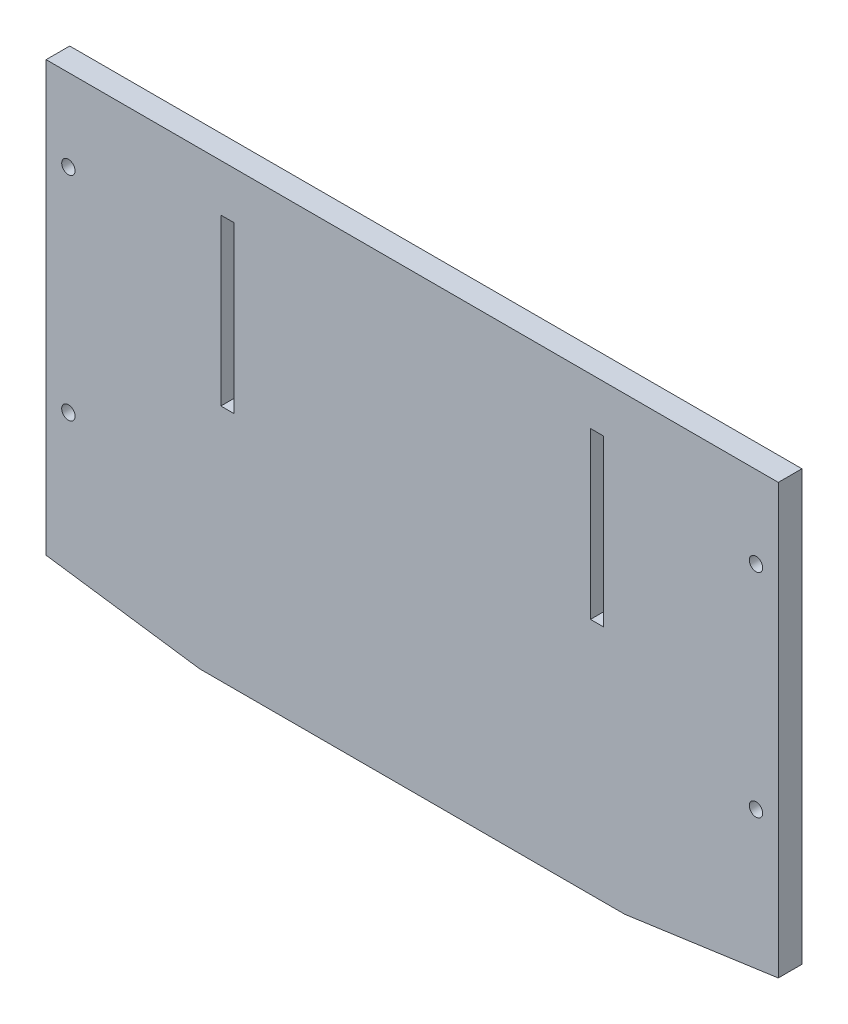
from build123d import *

# Parameters (mm, degrees)
SKETCH1_W            = 196.85
SKETCH1_H            = 127
BOSS_EXTRUDE1_DEPTH  = 6.35
M3_CLEARANCE_HOLE1_D = 3.6
SKETCH4_W            = 3.5052
SKETCH4_H            = 44.45
CUT_EXTRUDE1_DEPTH   = 235.348554508
CUT_EXTRUDE2_DEPTH   = 235.348554508
SKETCH6_W            = 114.3
SKETCH6_H            = 6.35
CUT_EXTRUDE3_DEPTH   = 235.348554508


with BuildPart() as part:
    # Sketch1 → Boss-Extrude1 (new body)
    with BuildSketch(Plane.XY):
        with Locations((98.425, 63.5)):
            Rectangle(SKETCH1_W, SKETCH1_H)
    extrude(amount=BOSS_EXTRUDE1_DEPTH)

    # M3 Clearance Hole1 (through all)
    with Locations(Plane.XY.offset(6.35)):
        with Locations((5.9944, 105.0036), (5.9944, 47.8536), (190.8556, 47.8536), (190.8556, 105.0036)):
            Hole(M3_CLEARANCE_HOLE1_D / 2)

    # Sketch4 → Cut-Extrude1 (cut, through all)
    with BuildSketch(Plane.XY.offset(6.35)):
        with Locations((48.7426, 92.075)):
            Rectangle(SKETCH4_W, SKETCH4_H)
        with Locations((148.1074, 92.075)):
            Rectangle(SKETCH4_W, SKETCH4_H)
    extrude(amount=-CUT_EXTRUDE1_DEPTH, mode=Mode.SUBTRACT)

    # Sketch5 → Cut-Extrude2 (cut, through all)
    with BuildSketch(Plane.XY.offset(6.35)):
        Polygon((0, 11.601645905), (82.55, 0), (0, 0), align=None)
        Polygon((114.3, 0), (196.85, 0), (196.85, 11.601645905), align=None)
    extrude(amount=-CUT_EXTRUDE2_DEPTH, mode=Mode.SUBTRACT)

    # Sketch6 → Cut-Extrude3 (cut, through all)
    with BuildSketch(Plane.XY.offset(6.35)):
        with Locations((98.425, 2.625822952)):
            Rectangle(SKETCH6_W, SKETCH6_H)
    extrude(amount=-CUT_EXTRUDE3_DEPTH, mode=Mode.SUBTRACT)


solid = part.part
